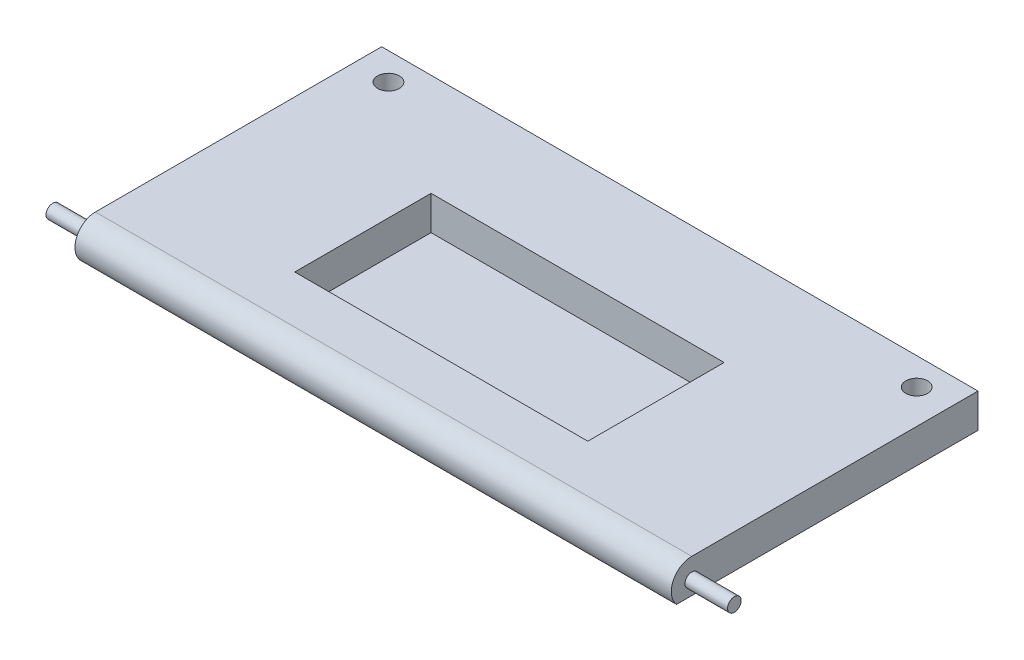
from build123d import *

# Parameters (mm, degrees)
EXTRUDE_1_DEPTH     = 45
SKETCH_2_W          = 43
SKETCH_2_H          = 20
CUT_EXTRUDE_2_DEPTH = 5
FILLET_2_R          = 3
EXTRUDE_START       = -43.75
SKETCH_4_R          = 1
EXTRUDE_2_DEPTH     = 50
CUT_EXTRUDE_3_REACH = 69.454
SKETCH_5_R          = 1.6


with BuildPart() as part:
    # 草图1 → 凸台-拉伸1 (new body)
    with BuildSketch(Plane.XY):
        Polygon((34, -2.5), (43.75, -2.5), (43.75, 2.5), (-43.75, 2.5), (-43.75, -2.5), (-34, -2.5), (-34, -3.5), (34, -3.5), align=None)
    extrude(amount=EXTRUDE_1_DEPTH)

    # 草图2 → 切除-拉伸2 (cut)
    with BuildSketch(Plane(origin=(0, 2.5, 0), x_dir=(1, 0, 0), z_dir=(0, 1, 0))):
        with Locations((0, -25)):
            Rectangle(SKETCH_2_W, SKETCH_2_H)
    extrude(amount=-CUT_EXTRUDE_2_DEPTH, mode=Mode.SUBTRACT)

    # 圆角2
    fillet_2_edges = [part.edges().sort_by_distance(p)[0] for p in [
        (0, -3.5, 45),
        (0, 2.5, 45),
    ]]
    fillet(fillet_2_edges, radius=FILLET_2_R - 0.0001)  # a hair under: the kernel refuses the full size

    # 草图4 → 凸台-拉伸2 (add, symmetric)
    with BuildSketch(Plane.ZY.offset(43.75).offset(EXTRUDE_START)):
        with Locations(Location((42, -0.5, 0), (0, 0, 180))):
            Circle(SKETCH_4_R)
    extrude(amount=EXTRUDE_2_DEPTH, both=True)

    # 草图5 → 切除-拉伸3 (cut, up to next)
    with BuildSketch(Plane.XZ.offset(2.5), mode=Mode.PRIVATE) as cut_extrude_3_sk1:
        with Locations(Location((-38.75, 4, 0), (0, 0, 270))):
            Circle(SKETCH_5_R)
    cut_extrude_3_tool1 = extrude(cut_extrude_3_sk1.sketch, amount=-CUT_EXTRUDE_3_REACH, mode=Mode.PRIVATE) & part.part
    cut_extrude_3 = cut_extrude_3_tool1.solids().sort_by_distance((-38.75, -2.5, 4))[0]
    add(cut_extrude_3, mode=Mode.SUBTRACT)

    # 镜向1: 切除-拉伸3 across plane
    add(cut_extrude_3.mirror(Plane(origin=(0, 0, 0), x_dir=(0, 0, 1), z_dir=(1, 0, 0))), mode=Mode.SUBTRACT)


solid = part.part
